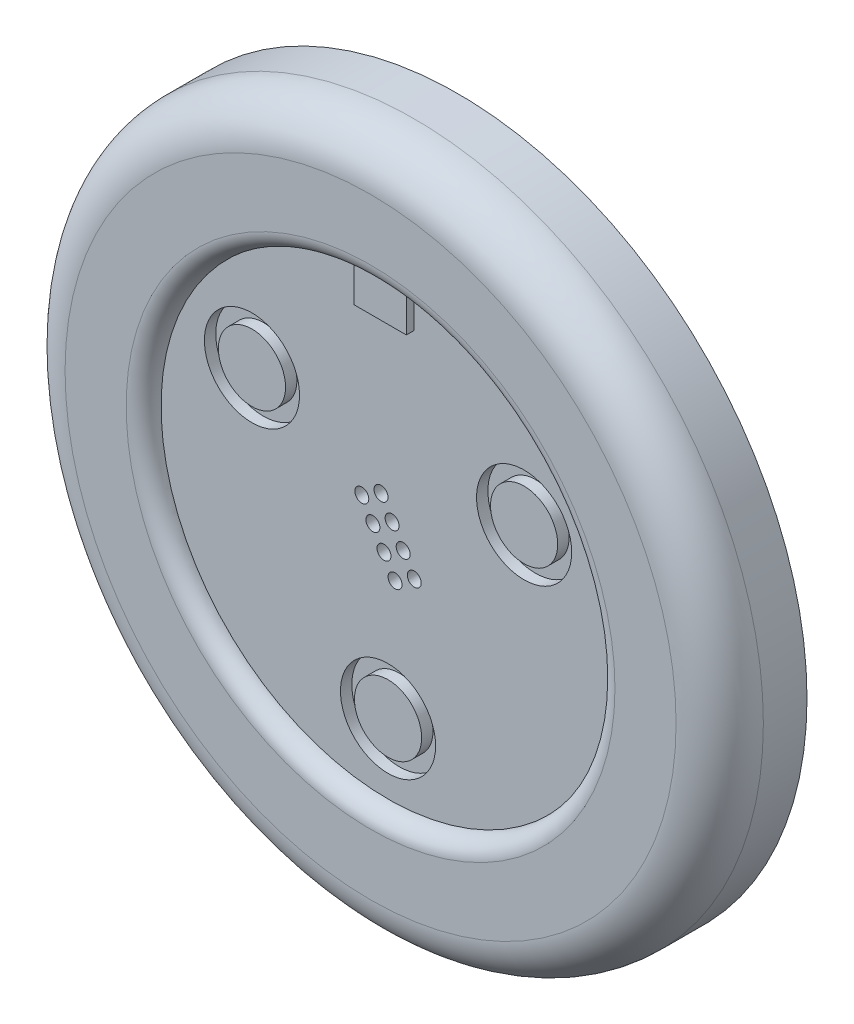
from build123d import *

# Parameters (mm, degrees)
SKETCH_1_R          = 40
EXTRUDE_1_DEPTH     = 10
SKETCH_3_R          = 26
CUT_EXTRUDE_1_DEPTH = 2
FILLET_2_R          = 5
SKETCH_7_R          = 5.45
SKETCH_7_R_2        = 3.85
CUT_EXTRUDE_3_DEPTH = 1.3
SHELL_2_T           = -2
SKETCH_9_R          = 3
SKETCH_9_R_2        = 1
EXTRUDE_2_DEPTH     = 8
EXTRUDE_2_2_DEPTH   = 8
EXTRUDE_2_3_DEPTH   = 8
EXTRUDE_5_DEPTH     = 0.9
SKETCH_11_R         = 33.900647102
CUT_EXTRUDE_5_DEPTH = 1.5
FILLET_3_R          = 2
SKETCH_12_R         = 0.8
CUT_EXTRUDE_6_DEPTH = 10


with BuildPart() as part:
    # 草图1 → 凸台-拉伸1 (new body)
    with BuildSketch(Plane.XY):
        Circle(SKETCH_1_R)
    extrude(amount=EXTRUDE_1_DEPTH)

    # 草图3 → 切除-拉伸1 (cut)
    with BuildSketch(Plane.XY.offset(10)):
        Circle(SKETCH_3_R)
    extrude(amount=-CUT_EXTRUDE_1_DEPTH, mode=Mode.SUBTRACT)

    # 圆角2
    fillet_2_edges = [part.edges().sort_by_distance(p)[0] for p in [
        (-40, 0, 10),
    ]]
    fillet(fillet_2_edges, radius=FILLET_2_R)

    # 草图7 → 切除-拉伸3 (cut)
    # profile 1 of 3: a face of its own
    with BuildSketch(Plane.XY.offset(8)):
        with Locations((0, -18)):
            Circle(SKETCH_7_R)
        with Locations((0, -18)):
            Circle(SKETCH_7_R_2, mode=Mode.SUBTRACT)
    # profile 2 of 3: a face of its own
    with BuildSketch(Plane.XY.offset(8)):
        with Locations((-15.588457268, 9)):
            Circle(SKETCH_7_R)
        with Locations((-15.588457268, 9)):
            Circle(SKETCH_7_R_2, mode=Mode.SUBTRACT)
    # profile 3 of 3: a face of its own
    with BuildSketch(Plane.XY.offset(8)):
        with Locations((15.588457268, 9)):
            Circle(SKETCH_7_R)
        with Locations((15.588457268, 9)):
            Circle(SKETCH_7_R_2, mode=Mode.SUBTRACT)
    extrude(amount=-CUT_EXTRUDE_3_DEPTH, mode=Mode.SUBTRACT)

    # 抽壳2
    shell_2_openings = [part.faces().sort_by_distance(p)[0] for p in [
        (0, 0, 0),
    ]]
    offset(amount=SHELL_2_T, openings=shell_2_openings, kind=Kind.INTERSECTION)

    # 圆角3
    fillet_3_edges = [part.edges().sort_by_distance(p)[0] for p in [
        (-26, 0, 10),
    ]]
    fillet(fillet_3_edges, radius=FILLET_3_R - 0.0001)  # a hair under: the kernel refuses the full size

    # 草图12 → 切除-拉伸6 (cut)
    with BuildSketch(Plane.XY.offset(8)):
        with Locations((-0.805147737, 3.934556788)):
            Circle(SKETCH_12_R)
        with Locations((0.464852263, 1.734852263)):
            Circle(SKETCH_12_R)
        with Locations((1.734852263, -0.464852263)):
            Circle(SKETCH_12_R)
        with Locations((3.004852263, -2.664556788)):
            Circle(SKETCH_12_R)
        with Locations((-1.734852263, 0.464852263)):
            Circle(SKETCH_12_R)
        with Locations((-0.464852263, -1.734852263)):
            Circle(SKETCH_12_R)
        with Locations((0.805147737, -3.934556788)):
            Circle(SKETCH_12_R)
        with Locations((-3.004852263, 2.664556788)):
            Circle(SKETCH_12_R)
    extrude(amount=-CUT_EXTRUDE_6_DEPTH, mode=Mode.SUBTRACT)


with BuildPart() as body_2:
    # 草图9 → 凸台-拉伸2 (new body)
    with BuildSketch(Plane(origin=(0, 0, 8), x_dir=(-1, 0, 0), z_dir=(0, 0, -1))):
        with Locations((0, -30)):
            Circle(SKETCH_9_R)
        with Locations((0, -30)):
            Circle(SKETCH_9_R_2, mode=Mode.SUBTRACT)
    extrude(amount=EXTRUDE_2_DEPTH)


with BuildPart() as body_3:
    # 草图9 → Extrude 2 2 (new body)
    with BuildSketch(Plane(origin=(0, 0, 8), x_dir=(-1, 0, 0), z_dir=(0, 0, -1))):
        with Locations((-25.980762114, 15)):
            Circle(SKETCH_9_R)
        with Locations((-25.980762114, 15)):
            Circle(SKETCH_9_R_2, mode=Mode.SUBTRACT)
    extrude(amount=EXTRUDE_2_2_DEPTH)


with BuildPart() as body_4:
    # 草图9 → Extrude 2 3 (new body)
    with BuildSketch(Plane(origin=(0, 0, 8), x_dir=(-1, 0, 0), z_dir=(0, 0, -1))):
        with Locations((25.980762114, 15)):
            Circle(SKETCH_9_R)
        with Locations((25.980762114, 15)):
            Circle(SKETCH_9_R_2, mode=Mode.SUBTRACT)
    extrude(amount=EXTRUDE_2_3_DEPTH)


with BuildPart() as body_5:
    # 草图10 → 凸台-拉伸5 (new body)
    with BuildSketch(Plane.XY.offset(8)):
        Polygon((0, 22), (3, 22), (3, 27), (-3, 27), (-3, 22), align=None)
    extrude(amount=EXTRUDE_5_DEPTH)


with BuildPart() as cut_extrude_5_tool:
    # 草图11 → 切除-拉伸5 (new body)
    with BuildSketch(Plane(origin=(0, 0, 0), x_dir=(-1, 0, 0), z_dir=(0, 0, -1))):
        Circle(SKETCH_11_R)
    extrude(amount=-CUT_EXTRUDE_5_DEPTH)


with BuildPart() as body_2_1:
    add(body_2.part)

    # 切除-拉伸5: cut by cut_extrude_5_tool
    add(cut_extrude_5_tool.part, mode=Mode.SUBTRACT)


with BuildPart() as body_3_1:
    add(body_3.part)

    # 切除-拉伸5: cut by cut_extrude_5_tool
    add(cut_extrude_5_tool.part, mode=Mode.SUBTRACT)


with BuildPart() as body_4_1:
    add(body_4.part)

    # 切除-拉伸5: cut by cut_extrude_5_tool
    add(cut_extrude_5_tool.part, mode=Mode.SUBTRACT)


solid = Compound([part.part, body_5.part, body_2_1.part, body_3_1.part, body_4_1.part])
